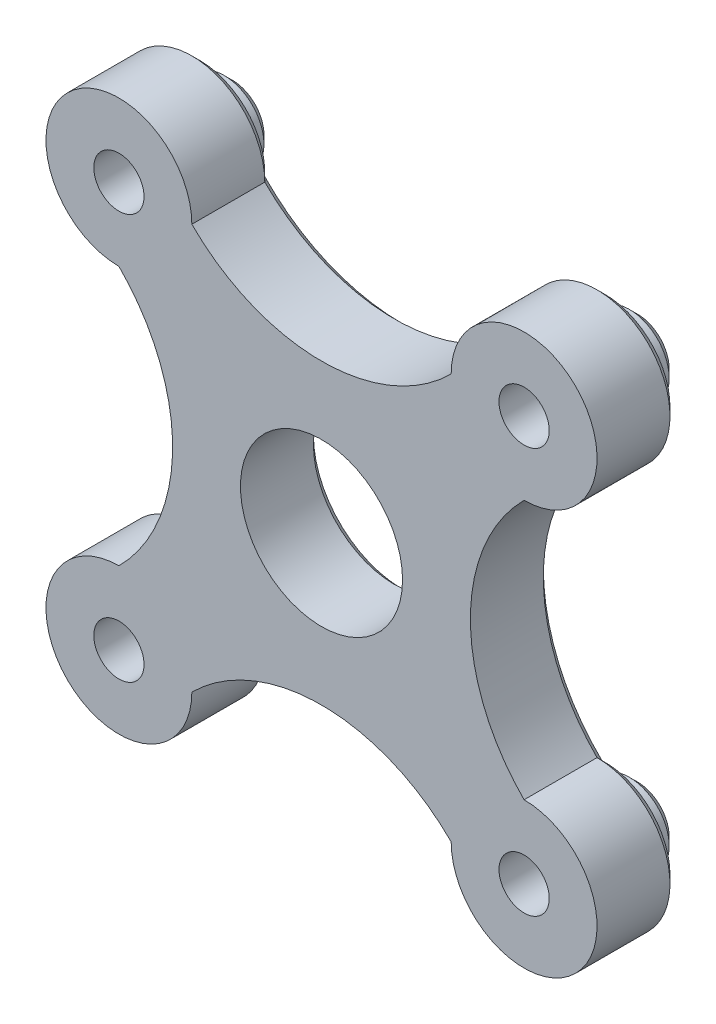
from build123d import *

# Parameters (mm, degrees)
CROQUIS1_R              = 2.4500000000000015
SALIENTE_EXTRUIR1_DEPTH = 2
SALIENTE_EXTRUIR2_DEPTH = 5
CROQUIS3_R              = 1.5499999999999992
CORTAR_EXTRUIR1_DEPTH   = 26.03996805109803
CROQUIS4_R              = 5
CORTAR_EXTRUIR2_DEPTH   = 5
CHAFL_N1_SIZE           = 0.5
CHAFL_N2_SIZE           = 0.5


with BuildPart() as part:
    # Croquis1 → Saliente-Extruir1 (new body)
    with BuildSketch(Plane.XY):
        with BuildLine():
            ThreePointArc((-10.049999999999738, -12.5), (-10.76758838609276, -10.767588386092894), (-12.499999999999918, -10.049999999999999))
            Line((-12.499999999999996, -10.049999999999997), (-12.499999999999996, -12.5))
            Line((-12.499999999999996, -12.5), (-10.049999999999738, -12.5))
        make_face()
        with BuildLine():
            Line((-12.499999999999996, -12.5), (-12.499999999999996, -10.049999999999997))
            ThreePointArc((-12.499999999999918, -10.049999999999999), (-14.232411613906718, -14.232411613907106), (-10.049999999999738, -12.5))
            Line((-10.049999999999738, -12.5), (-12.499999999999996, -12.5))
        make_face()
        with BuildLine():
            ThreePointArc((14.950000000000262, -12.5), (14.23241161390724, -10.767588386092894), (12.500000000000082, -10.049999999999999))
            Line((12.500000000000004, -10.05), (12.500000000000004, -12.499999999999996))
            Line((12.500000000000004, -12.499999999999996), (10.05000000000026, -12.499999999999996))
            ThreePointArc((10.05000000000026, -12.5), (12.500000000000261, -14.950000000000001), (14.950000000000262, -12.5))
        make_face()
        with BuildLine():
            Line((12.500000000000004, -12.499999999999996), (12.500000000000004, -10.05))
            ThreePointArc((12.500000000000082, -10.049999999999999), (10.767588386093156, -10.76758838609302), (10.05000000000026, -12.5))
            Line((10.05000000000026, -12.499999999999996), (12.500000000000004, -12.499999999999996))
        make_face()
        with BuildLine():
            ThreePointArc((-12.499999999999922, 10.049999999999999), (-10.76758838609293, 10.767588386092985), (-10.049999999999999, 12.5))
            Line((-10.049999999999997, 12.5), (-12.5, 12.5))
            Line((-12.5, 12.5), (-12.5, 10.049999999999999))
        make_face()
        with BuildLine():
            Line((-12.5, 12.5), (-10.049999999999997, 12.5))
            ThreePointArc((-10.049999999999999, 12.5), (-14.23241161390707, 14.232411613907015), (-12.499999999999922, 10.049999999999999))
            Line((-12.5, 10.049999999999999), (-12.5, 12.5))
        make_face()
        with Locations((12.5, 12.5)):
            Circle(CROQUIS1_R)
    extrude(amount=SALIENTE_EXTRUIR1_DEPTH)

    # Croquis2 → Saliente-Extruir2 (add)
    with BuildSketch(Plane.XY.offset(2)):
        with BuildLine():
            ThreePointArc((-7.999999999999958, 12.499999999999764), (-15.68198051533941, 15.681980515339577), (-12.5, 8))
            ThreePointArc((-12.5, 8), (-9.186291501015104, 5.367e-14), (-12.499999999999739, -8))
            ThreePointArc((-12.499999999999739, -8), (-15.681980515339163, -15.681980515339504), (-7.999999999999414, -12.499999999999883))
            ThreePointArc((-7.999999999999414, -12.499999999999883), (3.2112e-13, -9.18629150101557), (8.000000000000586, -12.499999999999618))
            ThreePointArc((8.000000000000586, -12.499999999999618), (15.681980515339447, -15.681980515339283), (12.500000000000016, -8.000000000000036))
            ThreePointArc((12.500000000000016, -8.000000000000036), (9.186291501015239, -2.647e-14), (12.50000000000002, 7.999999999999989))
            ThreePointArc((12.50000000000002, 7.999999999999989), (15.681980515339454, 15.68198051533949), (8.000000000000043, 12.49999999999997))
            ThreePointArc((8.000000000000043, 12.49999999999997), (8.613e-14, 9.1862915010151), (-7.999999999999958, 12.499999999999764))
        make_face()
    extrude(amount=SALIENTE_EXTRUIR2_DEPTH)

    # Croquis3 → Cortar-Extruir1 (cut, through all)
    with BuildSketch(Plane(origin=(0, 0, 0), x_dir=(-1, 0, 0), z_dir=(0, 0, -1))):
        with Locations((-12.500000000000261, -12.5)):
            Circle(CROQUIS3_R)
        with Locations((12.49999999999974, -12.5)):
            Circle(CROQUIS3_R)
        with Locations((12.499999999999654, 12.5)):
            Circle(CROQUIS3_R)
        with Locations((-12.500000000000348, 12.5)):
            Circle(CROQUIS3_R)
    extrude(amount=-CORTAR_EXTRUIR1_DEPTH, mode=Mode.SUBTRACT)

    # Croquis4 → Cortar-Extruir2 (cut)
    with BuildSketch(Plane.XY.offset(7)):
        Circle(CROQUIS4_R)
    extrude(amount=-CORTAR_EXTRUIR2_DEPTH, mode=Mode.SUBTRACT)

    # Chaflán1
    chafl_n1_edges = [part.edges().sort_by_distance(p)[0] for p in [
        (10.050000000000264, -12.5, 0),
        (-14.949999999999736, -12.5, 0),
        (-12.500000000000078, 14.950000000000001, 0),
        (10.049999999999999, 12.5, 0),
    ]]
    chamfer(chafl_n1_edges, length=CHAFL_N1_SIZE)

    # Chaflán2
    chafl_n2_edges = [part.edges().sort_by_distance(p)[0] for p in [
        (-15.681980515339374, 15.68198051533961, 2),
    ]]
    chamfer(chafl_n2_edges, length=CHAFL_N2_SIZE)
    chafl_n2_2_edges = [part.edges().sort_by_distance(p)[0] for p in [
        (8.438e-14, 9.186291501015104, 2),
    ]]
    chamfer(chafl_n2_2_edges, length=CHAFL_N2_SIZE)
    chafl_n2_3_edges = [part.edges().sort_by_distance(p)[0] for p in [
        (-9.186291501015104, 5.44e-14, 2),
    ]]
    chamfer(chafl_n2_3_edges, length=CHAFL_N2_SIZE)
    chafl_n2_4_edges = [part.edges().sort_by_distance(p)[0] for p in [
        (15.681980515339504, 15.681980515339442, 2),
    ]]
    chamfer(chafl_n2_4_edges, length=CHAFL_N2_SIZE - 0.0001)  # a hair under: the kernel refuses the full size
    chafl_n2_5_edges = [part.edges().sort_by_distance(p)[0] for p in [
        (-15.681980515338884, -15.68198051533978, 2),
    ]]
    chamfer(chafl_n2_5_edges, length=CHAFL_N2_SIZE)
    chafl_n2_6_edges = [part.edges().sort_by_distance(p)[0] for p in [
        (9.186291501015239, -2.132e-14, 2),
    ]]
    chamfer(chafl_n2_6_edges, length=CHAFL_N2_SIZE - 0.0001)  # a hair under: the kernel refuses the full size
    chafl_n2_7_edges = [part.edges().sort_by_distance(p)[0] for p in [
        (5.318e-13, -9.18629150101557, 2),
    ]]
    chamfer(chafl_n2_7_edges, length=CHAFL_N2_SIZE)
    chafl_n2_8_edges = [part.edges().sort_by_distance(p)[0] for p in [
        (15.681980515339694, -15.681980515339037, 2),
    ]]
    chamfer(chafl_n2_8_edges, length=CHAFL_N2_SIZE - 0.0004)  # a hair under: the kernel refuses the full size
    chafl_n2_9_edges = [part.edges().sort_by_distance(p)[0] for p in [
        (-5, 6.1e-16, 2),
    ]]
    chamfer(chafl_n2_9_edges, length=CHAFL_N2_SIZE)


solid = part.part
